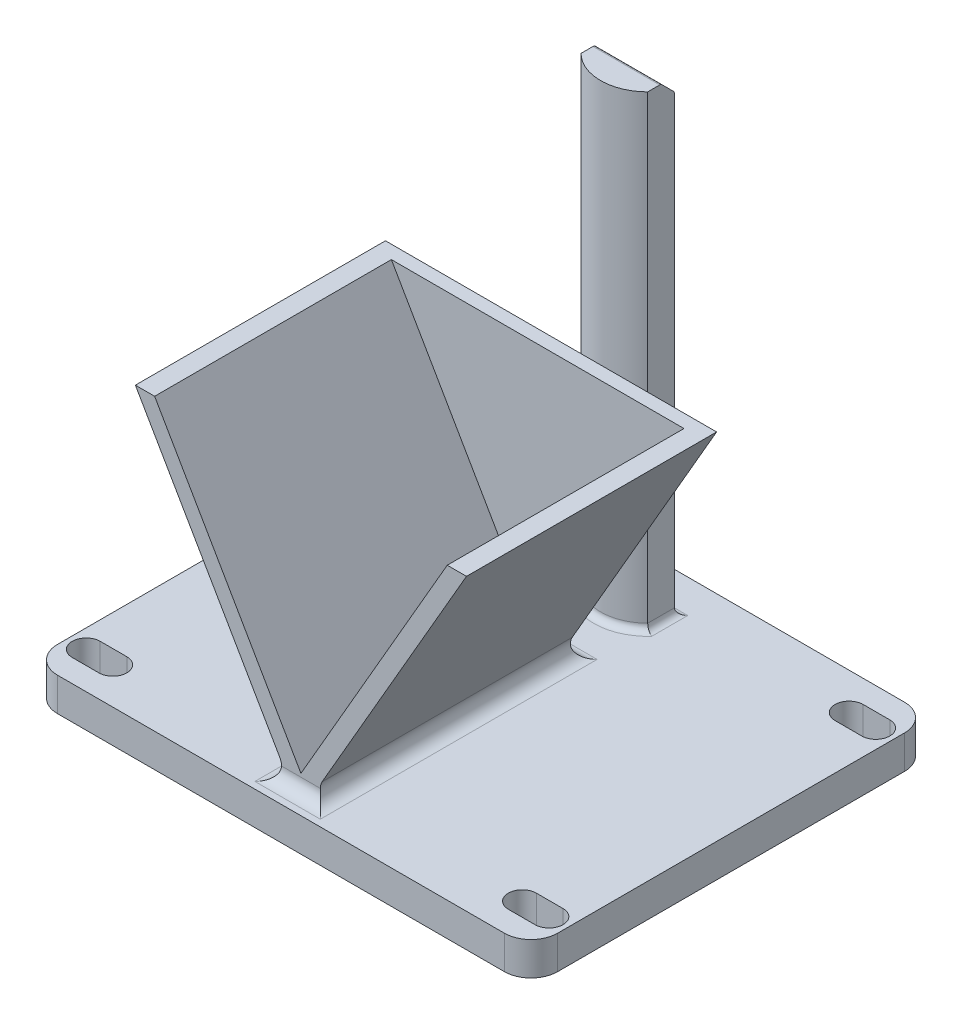
from build123d import *

# Parameters (mm, degrees)
BOSS_EXTRUDE1_DEPTH = 5
BOSS_EXTRUDE2_DEPTH = 37.5
BOSS_EXTRUDE4_DEPTH = 2
FILLET3_R           = 2
FILLET4_R           = 2
FILLET5_R           = 2
FILLET6_R           = 2
BOSS_EXTRUDE5_DEPTH = 70
FILLET7_R           = 1
CHAMFER2_SIZE       = 2
FILLET8_R           = 0.5
FILLET9_R           = 0.5
CUT_EXTRUDE2_DEPTH  = 85.889634232


with BuildPart() as part:
    # Sketch1 → Boss-Extrude1 (new body)
    with BuildSketch(Plane(origin=(0, 0, 0), x_dir=(1, 0, 0), z_dir=(0, 1, 0))):
        with BuildLine():
            Line((-33.5, -30), (33.5, -30))
            ThreePointArc((33.5, -30), (36.328427125, -28.828427125), (37.5, -26))
            Line((37.5, -26), (37.5, 26))
            ThreePointArc((37.5, 26), (36.328427125, 28.828427125), (33.5, 30))
            Line((33.5, 30), (-33.5, 30))
            ThreePointArc((-33.5, 30), (-36.328427125, 28.828427125), (-37.5, 26))
            Line((-37.5, 26), (-37.5, -26))
            ThreePointArc((-37.5, -26), (-36.328427125, -28.828427125), (-33.5, -30))
        make_face()
    extrude(amount=BOSS_EXTRUDE1_DEPTH)

    # Sketch11 → Boss-Extrude2 (add)
    with BuildSketch(Plane.XY.offset(27)):
        Polygon((0, 7.5), (21.939310229, 45.5), (24.826061575, 45.5), (1.443375673, 5), (-1.443375673, 5), (-24.826061575, 45.5), (-21.939310229, 45.5), align=None)
    extrude(amount=-BOSS_EXTRUDE2_DEPTH)

    # Sketch13 → Boss-Extrude4 (add)
    with BuildSketch(Plane(origin=(0, 0, -10.5), x_dir=(-1, 0, 0), z_dir=(0, 0, -1))):
        Polygon((-24.826061575, 45.5), (24.826061575, 45.5), (1.443375673, 5), (-1.443375673, 5), align=None)
    extrude(amount=-BOSS_EXTRUDE4_DEPTH)

    # Fillet3
    fillet3_edges = [part.edges().sort_by_distance(p)[0] for p in [
        (-1.443375673, 5, 8.25),
    ]]
    fillet(fillet3_edges, radius=FILLET3_R)

    # Fillet4
    fillet4_edges = [part.edges().sort_by_distance(p)[0] for p in [
        (1.443375673, 5, 8.25),
    ]]
    fillet(fillet4_edges, radius=FILLET4_R)

    # Fillet5
    fillet5_edges = [part.edges().sort_by_distance(p)[0] for p in [
        (0, 5, 27),
    ]]
    fillet(fillet5_edges, radius=FILLET5_R)

    # Fillet6
    fillet6_edges = [part.edges().sort_by_distance(p)[0] for p in [
        (0, 5, -10.5),
    ]]
    fillet(fillet6_edges, radius=FILLET6_R)

    # Sketch14 → Boss-Extrude5 (add)
    with BuildSketch(Plane(origin=(0, 5, 0), x_dir=(1, 0, 0), z_dir=(0, 1, 0))):
        with BuildLine():
            Line((-5, 20), (-5, 24))
            Line((-5, 24), (5, 24))
            Line((5, 24), (5, 20))
            ThreePointArc((5, 20), (0, 17.928932188), (-5, 20))
        make_face()
    extrude(amount=BOSS_EXTRUDE5_DEPTH)

    # Fillet7
    fillet7_edges = [part.edges().sort_by_distance(p)[0] for p in [
        (5, 5, -22),
        (0, 5, -17.928932188),
        (-5, 5, -22),
        (0, 5, -24),
    ]]
    fillet(fillet7_edges, radius=FILLET7_R)

    # Chamfer2
    chamfer2_edges = [part.edges().sort_by_distance(p)[0] for p in [
        (0, 75, -24),
    ]]
    chamfer(chamfer2_edges, length=CHAMFER2_SIZE)

    # Fillet8
    fillet8_edges = [part.edges().sort_by_distance(p)[0] for p in [
        (0, 73, -24),
    ]]
    fillet(fillet8_edges, radius=FILLET8_R)

    # Fillet9
    fillet9_edges = [part.edges().sort_by_distance(p)[0] for p in [
        (0, 75, -22),
    ]]
    fillet(fillet9_edges, radius=FILLET9_R)

    # Sketch15 → Cut-Extrude2 (cut, through all)
    with BuildSketch(Plane(origin=(0, 5, 0), x_dir=(1, 0, 0), z_dir=(0, 1, 0))):
        with BuildLine():
            Line((-34.7, -22.4), (-30.7, -22.4))
            ThreePointArc((-30.7, -22.4), (-28.6, -24.5), (-30.7, -26.6))
            Line((-30.7, -26.6), (-34.7, -26.6))
            ThreePointArc((-34.7, -26.6), (-36.8, -24.5), (-34.7, -22.4))
        make_face()
        with BuildLine():
            Line((34.7, -22.4), (30.7, -22.4))
            ThreePointArc((30.7, -22.4), (28.6, -24.5), (30.7, -26.6))
            Line((30.7, -26.6), (34.7, -26.6))
            ThreePointArc((34.7, -26.6), (36.8, -24.5), (34.7, -22.4))
        make_face()
        with BuildLine():
            Line((-34.7, 22.4), (-30.7, 22.4))
            ThreePointArc((-30.7, 22.4), (-28.6, 24.5), (-30.7, 26.6))
            Line((-30.7, 26.6), (-34.7, 26.6))
            ThreePointArc((-34.7, 26.6), (-36.8, 24.5), (-34.7, 22.4))
        make_face()
        with BuildLine():
            Line((34.7, 22.4), (30.7, 22.4))
            ThreePointArc((30.7, 22.4), (28.6, 24.5), (30.7, 26.6))
            Line((30.7, 26.6), (34.7, 26.6))
            ThreePointArc((34.7, 26.6), (36.8, 24.5), (34.7, 22.4))
        make_face()
    extrude(amount=-CUT_EXTRUDE2_DEPTH, mode=Mode.SUBTRACT)


solid = part.part
